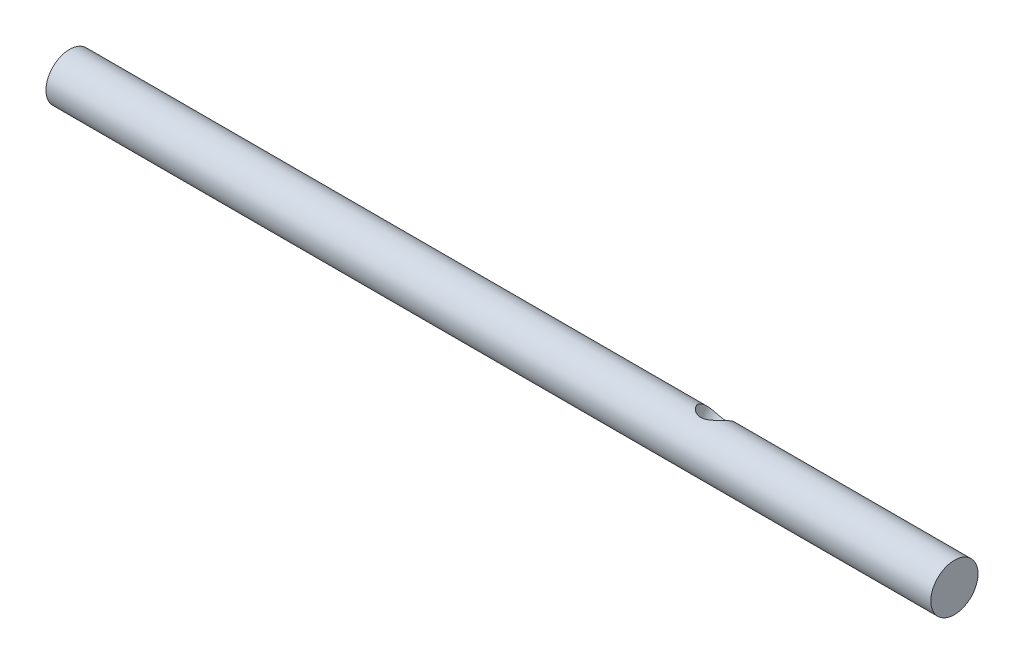
from build123d import *

# Parameters (mm, degrees)
SKETCH1_R           = 4
BOSS_EXTRUDE1_DEPTH = 75
SKETCH2_R           = 2.5
CUT_EXTRUDE1_DEPTH  = 1097


with BuildPart() as part:
    # Sketch1 → Boss-Extrude1 (new, symmetric)
    with BuildSketch(Plane(origin=(0, 0, 0), x_dir=(0, 0, -1), z_dir=(1, 0, 0))):
        Circle(SKETCH1_R)
    extrude(amount=BOSS_EXTRUDE1_DEPTH, both=True)

    # Sketch2 → Cut-Extrude1 (cut)
    with BuildSketch(Plane(origin=(-1373.627106081, 398.034078038, -1457.249478015), x_dir=(1.4749001727269878e-15, 0.5207916542268801, 0.853683813181221), z_dir=(2.073619932194005e-15, -0.853683813181221, 0.5207916542268801))):
        with Locations((1036.737465208, -1406.127106081)):
            Circle(SKETCH2_R)
    extrude(amount=CUT_EXTRUDE1_DEPTH, mode=Mode.SUBTRACT)


solid = part.part
